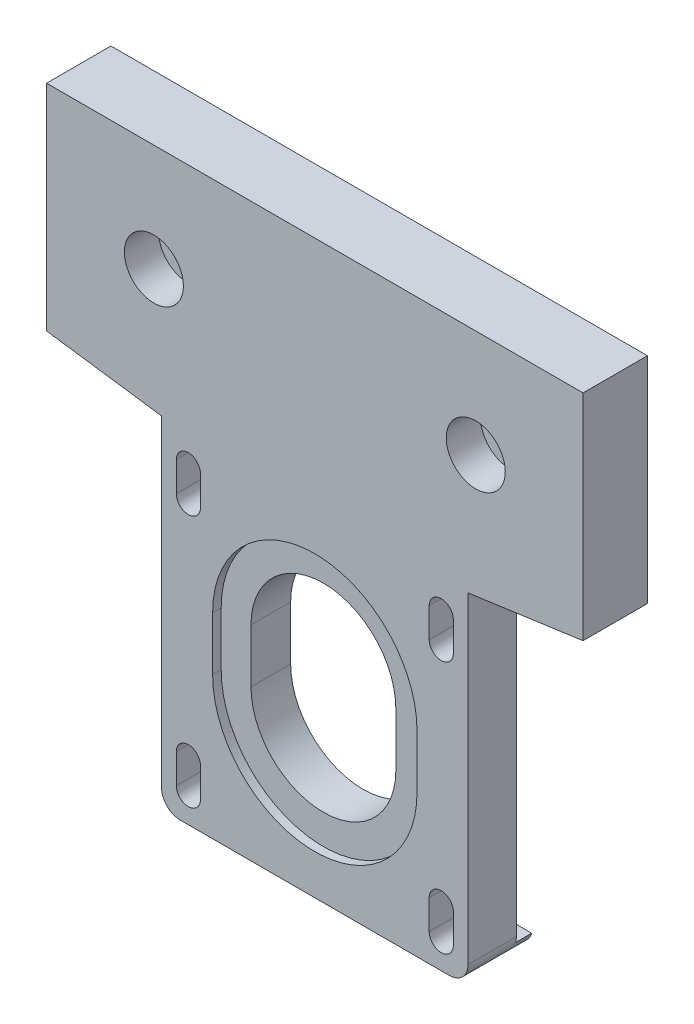
from build123d import *

# Parameters (mm, degrees)
EXTRUDE_1_DEPTH             = 12
HOLE_WIZARD_M61_D           = 6.6
HOLE_WIZARD_M61_CBORE_D     = 11
HOLE_WIZARD_M61_CBORE_DEPTH = 6.4
SKETCH_4_W                  = 57.15
SKETCH_4_H                  = 61
CUT_EXTRUDE_1_DEPTH         = 3
CUT_EXTRUDE_2_DEPTH         = 1.6
CUT_EXTRUDE_3_DEPTH         = 119.111853766
HOLE_START                  = -9
HOLE_WIZARD_M42_DEPTH       = 9


# Read off the part's stored shape, not the designer's step: Прорезь с зазором M42
with BuildPart() as part:
    # Эскиз1 → Бобышка-Вытянуть1 (new body)
    with BuildSketch(Plane.XY):
        with BuildLine():
            Line((-50, 0), (50, 0))
            Line((50, 0), (50, -40))
            Line((50, -40), (28.575, -43))
            Line((28.575, -43), (28.575, -103))
            ThreePointArc((28.575, -103), (27.549873734, -105.474873734), (25.075, -106.5))
            Line((25.075, -106.5), (-25.075, -106.5))
            ThreePointArc((-25.075, -106.5), (-27.549873734, -105.474873734), (-28.575, -103))
            Line((-28.575, -103), (-28.575, -43))
            Line((-28.575, -43), (-50, -40))
            Line((-50, -40), (-50, 0))
        make_face()
    extrude(amount=-EXTRUDE_1_DEPTH)

    # Цековка для  винта с внутренним шестигранником M61 (through all)
    with Locations(Plane.XY):
        with Locations((-30, -20), (30, -20)):
            CounterBoreHole(HOLE_WIZARD_M61_D / 2, HOLE_WIZARD_M61_CBORE_D / 2, HOLE_WIZARD_M61_CBORE_DEPTH)

    # Эскиз4 → Вырез-Вытянуть1 (cut)
    with BuildSketch(Plane(origin=(0, 0, -12), x_dir=(-1, 0, 0), z_dir=(0, 0, -1))):
        with Locations((0, -73.5)):
            Rectangle(SKETCH_4_W, SKETCH_4_H)
    extrude(amount=-CUT_EXTRUDE_1_DEPTH, mode=Mode.SUBTRACT)

    # Эскиз12 → Вырез-Вытянуть2 (cut)
    with BuildSketch(Plane.XY):
        with BuildLine():
            Line((-19.05, -80), (-19.05, -70))
            ThreePointArc((-19.05, -70), (0, -50.95), (19.05, -70))
            Line((19.05, -70), (19.05, -80))
            ThreePointArc((19.05, -80), (0, -99.05), (-19.05, -80))
        make_face()
    extrude(amount=-CUT_EXTRUDE_2_DEPTH, mode=Mode.SUBTRACT)

    # Эскиз13 → Вырез-Вытянуть3 (cut, through all)
    with BuildSketch(Plane.XY.offset(-1.6)):
        with BuildLine():
            Line((-13.5, -80), (-13.5, -70))
            ThreePointArc((-13.5, -70), (0, -56.5), (13.5, -70))
            Line((13.5, -70), (13.5, -80))
            ThreePointArc((13.5, -80), (0, -93.5), (-13.5, -80))
        make_face()
    extrude(amount=-CUT_EXTRUDE_3_DEPTH, mode=Mode.SUBTRACT)

    # Прорезь с зазором M42 outline → Прорезь с зазором M42 (cut)
    with BuildSketch(Plane.XY.offset(HOLE_START)):
        with BuildLine():
            ThreePointArc((-21.32, -95.82), (-23.57, -93.57), (-25.82, -95.82))
            Line((-25.82, -95.82), (-25.82, -101.32))
            ThreePointArc((-25.82, -101.32), (-23.57, -103.57), (-21.32, -101.32))
            Line((-21.32, -101.32), (-21.32, -95.82))
        make_face()
        with BuildLine():
            ThreePointArc((-21.32, -48.68), (-23.57, -46.43), (-25.82, -48.68))
            Line((-25.82, -48.68), (-25.82, -54.18))
            ThreePointArc((-25.82, -54.18), (-23.57, -56.43), (-21.32, -54.18))
            Line((-21.32, -54.18), (-21.32, -48.68))
        make_face()
        with BuildLine():
            ThreePointArc((25.82, -95.82), (23.57, -93.57), (21.32, -95.82))
            Line((21.32, -95.82), (21.32, -101.32))
            ThreePointArc((21.32, -101.32), (23.57, -103.57), (25.82, -101.32))
            Line((25.82, -101.32), (25.82, -95.82))
        make_face()
        with BuildLine():
            ThreePointArc((25.82, -48.68), (23.57, -46.43), (21.32, -48.68))
            Line((21.32, -48.68), (21.32, -54.18))
            ThreePointArc((21.32, -54.18), (23.57, -56.43), (25.82, -54.18))
            Line((25.82, -54.18), (25.82, -48.68))
        make_face()
    extrude(amount=HOLE_WIZARD_M42_DEPTH, mode=Mode.SUBTRACT)


solid = part.part
